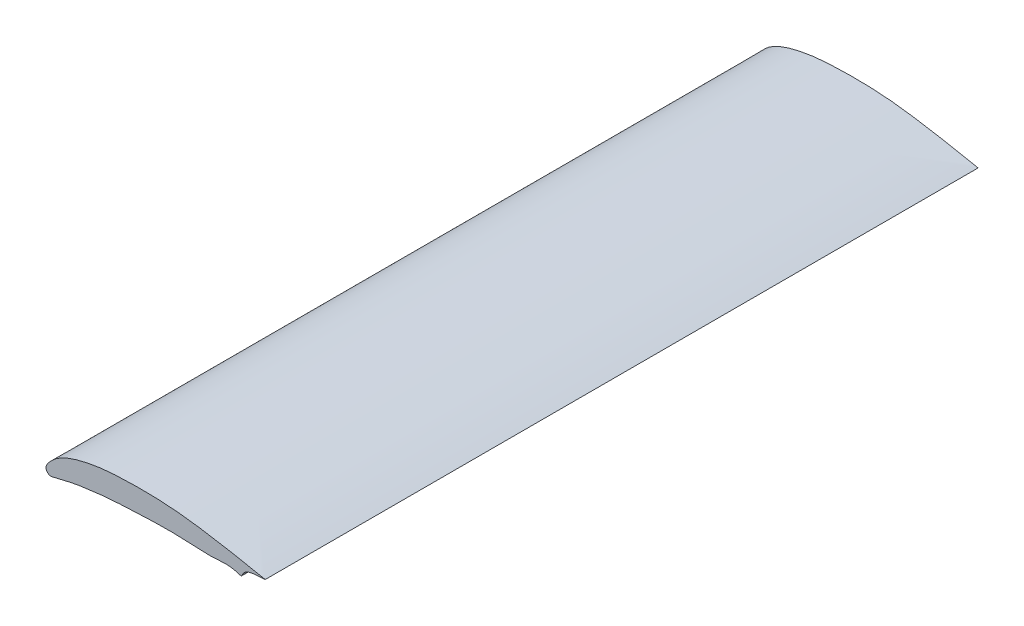
from build123d import *

# Parameters (mm, degrees)
BOSS_EXTRUDE1_DEPTH = 647.7


with BuildPart() as part:
    # cut sketch → Boss-Extrude1 (new body)
    with BuildSketch(Plane.XY):
        with BuildLine():
            add(Edge.make_bspline(
                [(198.755, 12.4341128), (197.958760534, 12.674892788), (193.016318766, 13.534169148), (188.294054353, 14.518485523), (182.85172621, 15.57923738), (170.951086301, 17.968884392), (152.188580231, 21.269451629), (126.82105562, 25.207670551), (101.321432861, 27.148849085), (75.878614338, 27.174929415), (54.634944714, 26.193996481), (37.720618746, 23.47384193), (27.137769344, 20.862450998), (18.699797435, 17.833624005), (12.223275623, 14.71753923), (6.863222639, 10.853018112), (2.512639265, 6.224815143), (-1.733104496, 0.897280663), (2.557540987, -4.25639396), (7.562017195, -3.186499038), (12.697615423, -1.980232946), (19.047489975, -0.424332295), (27.430473238, 1.485927044), (38.05107458, 2.872009756), (54.921214233, 5.06075421), (76.095993299, 6.251505502), (101.556610571, 7.373175065), (126.711669411, 7.317359933), (152.2220323, 5.028654081), (166.88520938, 7.943500364), (177.478911208, 3.860781859), (178.973218605, 7.146193578), (183.205786264, 13.092663651), (201.125228023, 11.717364261), (198.755, 12.4341128)],
                knots=[0, 0, 0, 0, 0.013065285, 0.026124911, 0.039193983, 0.052259268, 0.114883726, 0.177153765, 0.238898973, 0.300426496, 0.362023645, 0.393128504, 0.424784776, 0.441091662, 0.458148008, 0.477060579, 0.488020838, 0.50604562, 0.517776685, 0.525474169, 0.54122329, 0.556994005, 0.572702866, 0.603759277, 0.634700771, 0.696321728, 0.75785999, 0.819389386, 0.880956139, 0.936472049, 0.942641552, 0.944142165, 0.961107549, 1, 1, 1, 1], degree=3))
        make_face()
    extrude(amount=BOSS_EXTRUDE1_DEPTH)


solid = part.part
